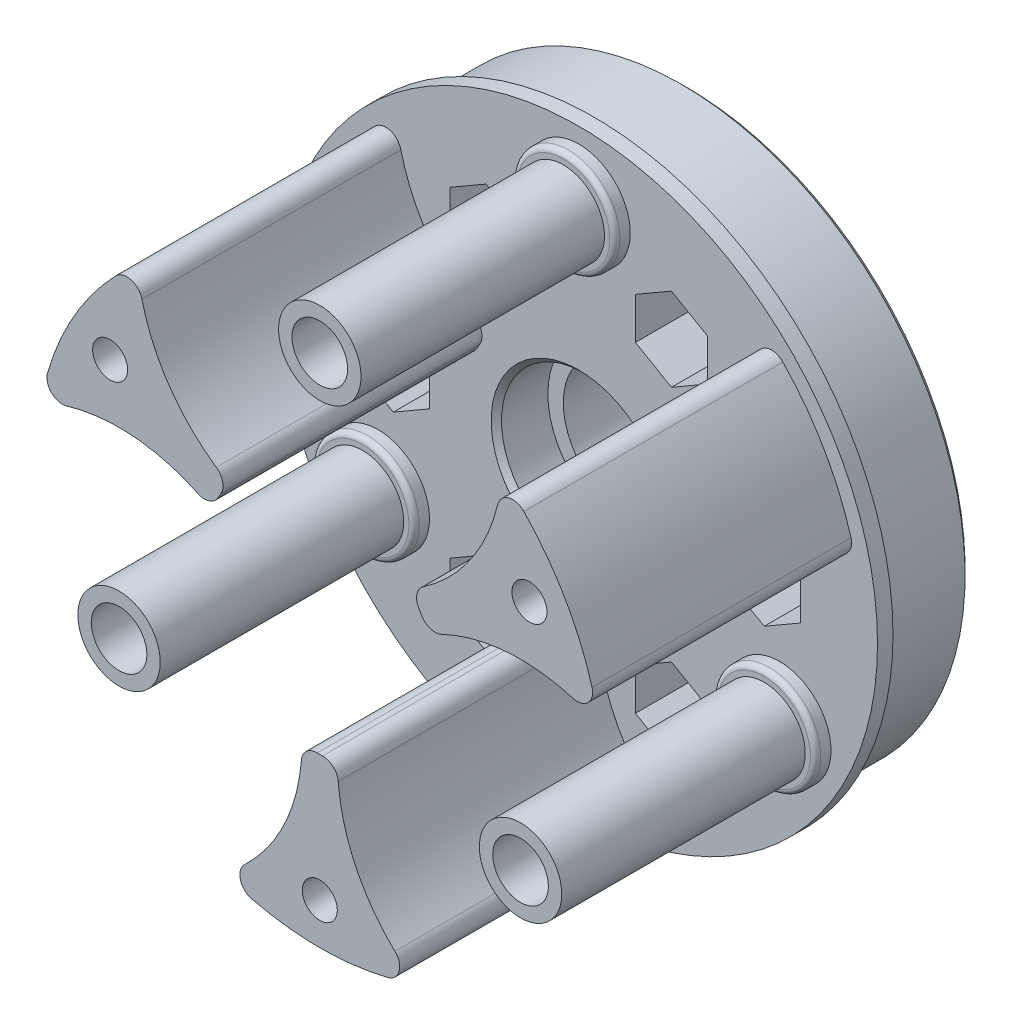
from build123d import *

# Parameters (mm, degrees)
SKETCH1_R                = 27.5
SKETCH1_R_2              = 2.7
BOSS_EXTRUDE1_DEPTH      = 10.5
SKETCH2_R                = 4
SKETCH2_R_2              = 2.7
BOSS_EXTRUDE2_DEPTH      = 25.1347981
SKETCH3_R                = 5
SKETCH3_R_2              = 4
BOSS_EXTRUDE3_DEPTH      = 1.5
BOSS_EXTRUDE4_DEPTH      = 25.1347981
FILLET2_R                = 0.5
FILLET5_R                = 1.5
CIRPATTERN1_COUNT        = 3
FILLET2_OF_CIRPATTERN1_R = 0.5
FILLET5_OF_CIRPATTERN1_R = 1.5
SKETCH5_R                = 1.7
CUT_EXTRUDE1_DEPTH       = 53.747879916
SKETCH6_R                = 3.15
CUT_EXTRUDE2_DEPTH       = 3
SKETCH7_R                = 4.65
CUT_EXTRUDE3_DEPTH       = 5
CIRPATTERN2_COUNT        = 3
CHAMFER1_SIZE            = 0.5
SKETCH9_R                = 8
CUT_EXTRUDE4_DEPTH       = 47.306134437
BOSS_EXTRUDE7_START      = -5.5
SKETCH10_R               = 8
SKETCH10_R_2             = 6.5
BOSS_EXTRUDE7_DEPTH      = 5.5
CHAMFER2_SIZE            = 0.5
BOSS_EXTRUDE8_START      = -1.5
SKETCH11_R               = 29
SKETCH11_R_2             = 27.5
BOSS_EXTRUDE8_DEPTH      = 1.5
SKETCH12_R               = 2.2
CUT_EXTRUDE5_DEPTH       = 55.330827673
CUT_EXTRUDE6_DEPTH       = 6
CIRPATTERN3_COUNT        = 6


with BuildPart() as part:
    # Sketch1 → Boss-Extrude1 (new body)
    with BuildSketch(Plane.XY):
        with Locations(Location((0, 0, 0), (0, 0, 180))):
            Circle(SKETCH1_R)
        with Locations(Location((0, 22.5, 0), (0, 0, 180))):
            Circle(SKETCH1_R_2, mode=Mode.SUBTRACT)
        with Locations(Location((19.485571585, -11.25, 0), (0, 0, 180))):
            Circle(SKETCH1_R_2, mode=Mode.SUBTRACT)
        with Locations(Location((-19.485571585, -11.25, 0), (0, 0, 180))):
            Circle(SKETCH1_R_2, mode=Mode.SUBTRACT)
    extrude(amount=BOSS_EXTRUDE1_DEPTH)

    # Sketch2 → Boss-Extrude2 (add)
    with BuildSketch(Plane.XY.offset(10.5)):
        with Locations((0, 22.5)):
            Circle(SKETCH2_R)
        with Locations(Location((0, 22.5, 0), (0, 0, 180))):
            Circle(SKETCH2_R_2, mode=Mode.SUBTRACT)
    boss_extrude2 = extrude(amount=BOSS_EXTRUDE2_DEPTH)

    # Sketch3 → Boss-Extrude3 (add)
    with BuildSketch(Plane.XY.offset(10.5)):
        with Locations(Location((0, 22.5, 0), (0, 0, 90))):
            Circle(SKETCH3_R)
        with Locations((0, 22.5)):
            Circle(SKETCH3_R_2, mode=Mode.SUBTRACT)
    boss_extrude3 = extrude(amount=BOSS_EXTRUDE3_DEPTH)

    # Sketch4 → Boss-Extrude4 (add)
    with BuildSketch(Plane.XY.offset(10.5)):
        with BuildLine():
            ThreePointArc((-8.758036873, 7.061111111), (-14.961266907, 12.948927153), (-17.691016533, 21.054166667))
            ThreePointArc((-17.691016533, 21.054166667), (-23.815698604, 13.75), (-27.078951455, 4.793786403))
            ThreePointArc((-27.078951455, 4.793786403), (-18.69473332, 6.482373638), (-10.494120038, 4.054126864))
            ThreePointArc((-10.494120038, 4.054126864), (-9.742785793, 5.625), (-8.758036873, 7.061111111))
        make_face()
    boss_extrude4 = extrude(amount=BOSS_EXTRUDE4_DEPTH)

    # Fillet2
    fillet2_edges = [part.edges().sort_by_distance(p)[0] for p in [
        (0, 17.5, 12),
    ]]
    fillet(fillet2_edges, radius=FILLET2_R)

    # Fillet5
    # the kernel refuses this fillet: 1.5 mm, written as the material it takes off along each edge
    with BuildSketch(Plane(origin=(-17.691016533, 21.054166667, 10.5), x_dir=(0.15709264803000278, -0.9875838698231769, 0), z_dir=(0, 0, 1))) as fillet5_piece_1:
        with BuildLine():
            CenterArc((2.816683794, -1.495647241), FILLET5_R, 94.365956178, 122.668168748)
            ThreePointArc((1.619268396, -2.399083108), (0.778048956, -1.220860108), (0, 0))
            ThreePointArc((0, 0), (1.351246955, -0.051507644), (2.70249391, 0))
        make_face()
    extrude(amount=32.370832017, mode=Mode.SUBTRACT)
    with BuildSketch(Plane(origin=(-27.078951455, 4.793786403, 10.5), x_dir=(0.9338190436496157, 0.3577457109698411, 0), z_dir=(0, 0, 1))) as fillet5_piece_2:
        with BuildLine():
            CenterArc((2.816683794, 1.495647241), FILLET5_R, 142.965875074, 122.668168748)
            ThreePointArc((1.619268396, 2.399083108), (0.778048956, 1.220860108), (0, 0))
            ThreePointArc((0, 0), (1.351246955, 0.051507644), (2.70249391, 0))
        make_face()
    extrude(amount=32.370832017, mode=Mode.SUBTRACT)
    with BuildSketch(Plane(origin=(-10.494120038, 4.054126864, 10.5), x_dir=(-0.8830459816665128, 0.46928647355599856, 0), z_dir=(0, 0, 1))) as fillet5_piece_3:
        with BuildLine():
            CenterArc((1.579734138, -1.498632196), FILLET5_R, 92.447016774, 86.861534246)
            ThreePointArc((0.079843366, -1.480530543), (0.06433884, -0.738948482), (0, 0))
            ThreePointArc((0, 0), (0.757845431, -0.016185681), (1.515690862, 0))
        make_face()
    extrude(amount=28.924025256, mode=Mode.SUBTRACT)
    with BuildSketch(Plane(origin=(-8.758036873, 7.061111111, 10.5), x_dir=(-0.5749897938149383, -0.8181605814316983, 0), z_dir=(0, 0, 1))) as fillet5_piece_4:
        with BuildLine():
            CenterArc((1.581527373, -1.496739648), FILLET5_R, 93.778356387, 86.861534246)
            ThreePointArc((0.081620919, -1.513491598), (0.056972655, -0.75587419), (0, 0))
            ThreePointArc((0, 0), (0.741340956, -0.024452638), (1.482681912, 0))
        make_face()
    extrude(amount=28.924025256, mode=Mode.SUBTRACT)

    # CirPattern1: Boss-Extrude2, Boss-Extrude3, Boss-Extrude4 ×3 about axis
    cirpattern1_axis = Axis((0, 0, 0), (0, 0, 1))
    add([boss_extrude2.rotate(cirpattern1_axis, i * 360 / CIRPATTERN1_COUNT) for i in range(1, CIRPATTERN1_COUNT)])
    add([boss_extrude3.rotate(cirpattern1_axis, i * 360 / CIRPATTERN1_COUNT) for i in range(1, CIRPATTERN1_COUNT)])
    add([boss_extrude4.rotate(cirpattern1_axis, i * 360 / CIRPATTERN1_COUNT) for i in range(1, CIRPATTERN1_COUNT)])

    # Fillet2 of CirPattern1
    fillet2_of_cirpattern1_edges = [part.edges().sort_by_distance(p)[0] for p in [
        (-15.155444566, -8.75, 12),
        (15.155444566, -8.75, 12),
    ]]
    fillet(fillet2_of_cirpattern1_edges, radius=FILLET2_OF_CIRPATTERN1_R)

    # Fillet5 of CirPattern1
    # the kernel refuses this fillet: 1.5 mm, written as the material it takes off along each edge
    with BuildSketch(Plane(origin=(-9.387934922, -25.84795307, 10.5), x_dir=(0.9565884515912854, -0.2914421628422817, 0), z_dir=(0, 0, 1))) as fillet5_of_cirpattern1_piece_1:
        with BuildLine():
            CenterArc((2.815475015, 1.497921462), FILLET5_OF_CIRPATTERN1_R, 150.348455325, 122.668168748)
            ThreePointArc((1.511899691, 2.24000729), (0.798642818, 1.091187894), (0, 0))
            ThreePointArc((0, 0), (1.447206783, -0.038106538), (2.894413567, 0))
        make_face()
    extrude(amount=32.370832017, mode=Mode.SUBTRACT)
    with BuildSketch(Plane(origin=(9.387934922, -25.84795307, 10.5), x_dir=(-0.9565884515912714, -0.29144216284232777, 0), z_dir=(0, 0, 1))) as fillet5_of_cirpattern1_piece_2:
        with BuildLine():
            CenterArc((2.815475015, -1.497921462), FILLET5_OF_CIRPATTERN1_R, 86.983375927, 122.668168748)
            ThreePointArc((1.511899691, -2.24000729), (0.798642818, -1.091187894), (0, 0))
            ThreePointArc((0, 0), (1.447206783, 0.038106538), (2.894413567, 0))
        make_face()
    extrude(amount=32.370832017, mode=Mode.SUBTRACT)
    with BuildSketch(Plane(origin=(1.736083164, -11.115237975, 10.5), x_dir=(0.03510898308134655, -0.999383489610967, 0), z_dir=(0, 0, 1)), Plane(origin=(8.758036873, 7.061111111, 10.5), x_dir=(0.8479369985851659, 0.5300970160549674, 0), z_dir=(0, 0, 1))) as fillet5_of_cirpattern1_piece_3:
        with BuildLine():
            CenterArc((1.579734138, -1.498632196), FILLET5_OF_CIRPATTERN1_R, 92.447016774, 86.861534246)
            ThreePointArc((0.079843366, -1.480530543), (0.06433884, -0.738948482), (0, 0))
            ThreePointArc((0, 0), (0.757845431, -0.016185681), (1.515690862, 0))
        make_face()
    extrude(amount=28.924025256, mode=Mode.SUBTRACT)
    with BuildSketch(Plane(origin=(-1.736083164, -11.115237975, 10.5), x_dir=(0.9960427448023668, -0.0888754776446648, 0), z_dir=(0, 0, 1)), Plane(origin=(10.494120038, 4.054126864, 10.5), x_dir=(-0.4210529509874265, 0.9070360590763632, 0), z_dir=(0, 0, 1))) as fillet5_of_cirpattern1_piece_4:
        with BuildLine():
            CenterArc((1.581527373, -1.496739648), FILLET5_OF_CIRPATTERN1_R, 93.778356387, 86.861534246)
            ThreePointArc((0.081620919, -1.513491598), (0.056972655, -0.75587419), (0, 0))
            ThreePointArc((0, 0), (0.741340956, -0.024452638), (1.482681912, 0))
        make_face()
    extrude(amount=28.924025256, mode=Mode.SUBTRACT)
    with BuildSketch(Plane(origin=(27.078951455, 4.793786403, 10.5), x_dir=(-0.9338190436496145, 0.3577457109698444, 0), z_dir=(0, 0, 1))) as fillet5_of_cirpattern1_piece_5:
        with BuildLine():
            CenterArc((2.816683794, -1.495647241), FILLET5_OF_CIRPATTERN1_R, 94.365956178, 122.668168748)
            ThreePointArc((1.619268396, -2.399083108), (0.778048956, -1.220860108), (0, 0))
            ThreePointArc((0, 0), (1.351246955, -0.051507644), (2.70249391, 0))
        make_face()
    extrude(amount=32.370832017, mode=Mode.SUBTRACT)
    with BuildSketch(Plane(origin=(17.691016533, 21.054166667, 10.5), x_dir=(-0.1570926480299918, -0.9875838698231787, 0), z_dir=(0, 0, 1))) as fillet5_of_cirpattern1_piece_6:
        with BuildLine():
            CenterArc((2.816683794, 1.495647241), FILLET5_OF_CIRPATTERN1_R, 142.965875074, 122.668168748)
            ThreePointArc((1.619268396, 2.399083108), (0.778048956, 1.220860108), (0, 0))
            ThreePointArc((0, 0), (1.351246955, 0.051507644), (2.70249391, 0))
        make_face()
    extrude(amount=32.370832017, mode=Mode.SUBTRACT)

    # Sketch5 → Cut-Extrude1 (cut, through all)
    with BuildSketch(Plane.XY.offset(35.6347981)):
        with Locations((-20.351596989, 11.75)):
            Circle(SKETCH5_R)
    cut_extrude1 = extrude(amount=-CUT_EXTRUDE1_DEPTH, mode=Mode.SUBTRACT)

    # Sketch6 → Cut-Extrude2 (cut)
    with BuildSketch(Plane(origin=(0, 0, 0), x_dir=(-1, 0, 0), z_dir=(0, 0, -1))):
        with Locations((20.351596989, 11.75)):
            Circle(SKETCH6_R)
    cut_extrude2 = extrude(amount=-CUT_EXTRUDE2_DEPTH, mode=Mode.SUBTRACT)

    # Sketch7 → Cut-Extrude3 (cut)
    with BuildSketch(Plane(origin=(0, 0, 0), x_dir=(-1, 0, 0), z_dir=(0, 0, -1))):
        with Locations((0, 22.5)):
            Circle(SKETCH7_R)
    cut_extrude3 = extrude(amount=-CUT_EXTRUDE3_DEPTH, mode=Mode.SUBTRACT)

    # CirPattern2: Cut-Extrude1, Cut-Extrude2, Cut-Extrude3 ×3 about axis
    cirpattern2_axis = Axis((0, 0, 0), (0, 0, 1))
    add([cut_extrude1.rotate(cirpattern2_axis, i * 360 / CIRPATTERN2_COUNT) for i in range(1, CIRPATTERN2_COUNT)], mode=Mode.SUBTRACT)
    add([cut_extrude2.rotate(cirpattern2_axis, i * 360 / CIRPATTERN2_COUNT) for i in range(1, CIRPATTERN2_COUNT)], mode=Mode.SUBTRACT)
    add([cut_extrude3.rotate(cirpattern2_axis, i * 360 / CIRPATTERN2_COUNT) for i in range(1, CIRPATTERN2_COUNT)], mode=Mode.SUBTRACT)

    # Chamfer1
    # the kernel refuses this chamfer: 0.5 mm, written as the material it takes off along each edge
    with BuildSketch(Plane(origin=(0, 0, 0), x_dir=(-1, 0, 0), z_dir=(0, 1, 0))) as chamfer1_piece_1:
        Polygon((27.5 - CHAMFER1_SIZE, 0), (27.5, CHAMFER1_SIZE), (27.5, 0), align=None)
    revolve(axis=Axis((0, 0, 0), (0, 0, 1)), mode=Mode.SUBTRACT)

    # Sketch9 → Cut-Extrude4 (cut, through all)
    with BuildSketch(Plane.XY.offset(10.5)):
        Circle(SKETCH9_R)
    extrude(amount=-CUT_EXTRUDE4_DEPTH, mode=Mode.SUBTRACT)

    # Sketch10 → Boss-Extrude7 (add)
    with BuildSketch(Plane(origin=(0, 0, 0), x_dir=(-1, 0, 0), z_dir=(0, 0, -1)).offset(BOSS_EXTRUDE7_START)):
        with Locations(Location((0, 0, 0), (0, 0, 180))):
            Circle(SKETCH10_R)
        Circle(SKETCH10_R_2, mode=Mode.SUBTRACT)
    extrude(amount=BOSS_EXTRUDE7_DEPTH)

    # Chamfer2
    chamfer2_edges = [part.edges().sort_by_distance(p)[0] for p in [
        (-8, 0, 10.5),
    ]]
    chamfer(chamfer2_edges, length=CHAMFER2_SIZE)

    # Sketch11 → Boss-Extrude8 (add)
    with BuildSketch(Plane.XY.offset(10.5).offset(BOSS_EXTRUDE8_START)):
        Circle(SKETCH11_R)
        with Locations(Location((0, 0, 0), (0, 0, 180))):
            Circle(SKETCH11_R_2, mode=Mode.SUBTRACT)
    extrude(amount=BOSS_EXTRUDE8_DEPTH)

    # Sketch12 → Cut-Extrude5 (cut, through all)
    with BuildSketch(Plane(origin=(0, 0, 0), x_dir=(-1, 0, 0), z_dir=(0, 0, -1))):
        with Locations((-9, 15.588457268)):
            Circle(SKETCH12_R)
    cut_extrude5 = extrude(amount=-CUT_EXTRUDE5_DEPTH, mode=Mode.SUBTRACT)

    # Sketch13 → Cut-Extrude6 (cut)
    with BuildSketch(Plane.XY.offset(10.5)):
        Polygon((12.5, 13.567731326), (12.5, 17.60918321), (9, 19.629909152), (5.5, 17.60918321), (5.5, 13.567731326), (9, 11.547005384), align=None)
    cut_extrude6 = extrude(amount=-CUT_EXTRUDE6_DEPTH, mode=Mode.SUBTRACT)

    # CirPattern3: Cut-Extrude5, Cut-Extrude6 ×6 about axis
    cirpattern3_axis = Axis((0, 0, 0), (0, 0, 1))
    add([cut_extrude5.rotate(cirpattern3_axis, i * 360 / CIRPATTERN3_COUNT) for i in range(1, CIRPATTERN3_COUNT)], mode=Mode.SUBTRACT)
    add([cut_extrude6.rotate(cirpattern3_axis, i * 360 / CIRPATTERN3_COUNT) for i in range(1, CIRPATTERN3_COUNT)], mode=Mode.SUBTRACT)


solid = part.part
